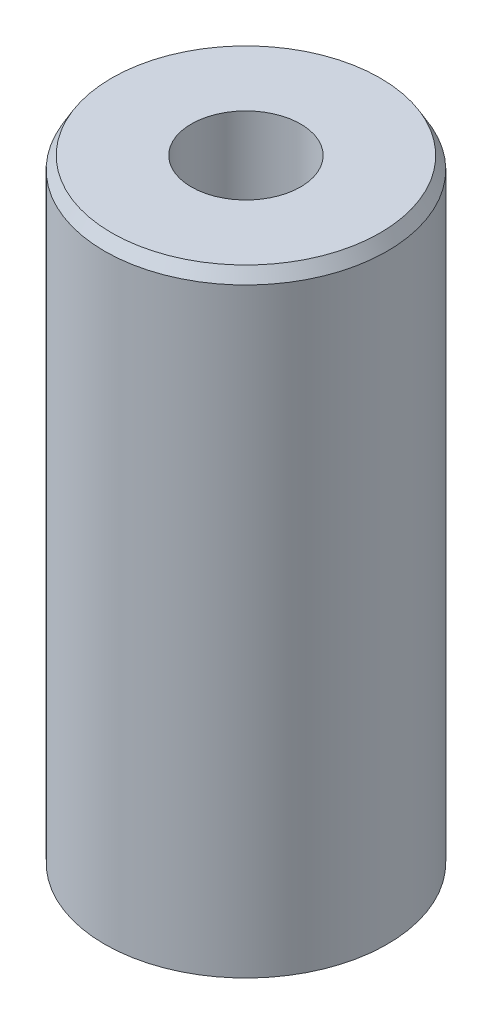
from build123d import *
from OCP.BRepFilletAPI import BRepFilletAPI_MakeChamfer

# Parameters (mm, degrees)
SKETCH1_R           = 37.5
BOSS_EXTRUDE1_DEPTH = 164.434164135
SKETCH2_R           = 14.494820522
CUT_EXTRUDE1_DEPTH  = 173.774692403
CHAMFER1_SIZE       = 3.261830186
CHAMFER1_SIZE2      = 1.883218536


with BuildPart() as part:
    # Sketch1 → Boss-Extrude1 (new body)
    with BuildSketch(Plane(origin=(0, 0, 0), x_dir=(1, 0, 0), z_dir=(0, 1, 0))):
        Circle(SKETCH1_R)
    extrude(amount=BOSS_EXTRUDE1_DEPTH)

    # Sketch2 → Cut-Extrude1 (cut, through all)
    with BuildSketch(Plane(origin=(0, 0, 0), x_dir=(1, 0, 0), z_dir=(0, 1, 0))):
        Circle(SKETCH2_R)
    extrude(amount=CUT_EXTRUDE1_DEPTH, mode=Mode.SUBTRACT)

    # Chamfer1: one chamfer whose edges measure the first distance from different faces: ONE call of the kernel's chamfer builder (chamfer() names one face for all edges)
    chamfer1_edges_1 = [part.edges().sort_by_distance(p)[0] for p in [
        (-37.5, 164.434164135, 0),
    ]]
    chamfer1_side_1 = [part.faces().sort_by_distance(p)[0] for p in [
        (-37.5, 82.217082068, 0),
    ]]
    chamfer1_edges_2 = [part.edges().sort_by_distance(p)[0] for p in [
        (-37.5, 0, 0),
    ]]
    chamfer1_side_2 = [part.faces().sort_by_distance(p)[0] for p in [
        (-36.439339828, 0, 0),
    ]]
    chamfer1 = BRepFilletAPI_MakeChamfer(part.part.solid().wrapped)
    for e in chamfer1_edges_1:
        chamfer1.Add(CHAMFER1_SIZE, CHAMFER1_SIZE2, e.wrapped, chamfer1_side_1[0].wrapped)  # the first distance lies on this face
    for e in chamfer1_edges_2:
        chamfer1.Add(CHAMFER1_SIZE, CHAMFER1_SIZE2, e.wrapped, chamfer1_side_2[0].wrapped)  # the first distance lies on this face
    add(Compound.cast(chamfer1.Shape()), mode=Mode.REPLACE)


solid = part.part
